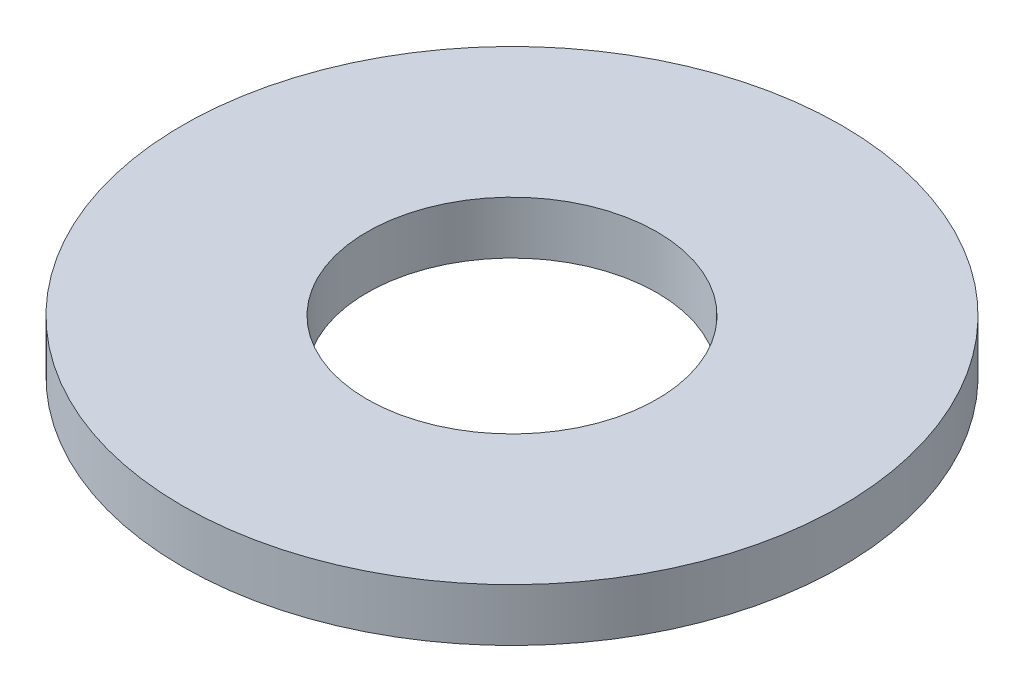
from build123d import *

# Parameters (mm, degrees)
SKETCH1_R           = 2.5
BOSS_EXTRUDE1_DEPTH = 0.4
SKETCH5_R           = 1.1
CUT_EXTRUDE1_DEPTH  = 4.558089375


with BuildPart() as part:
    # Sketch1 → Boss-Extrude1 (new body)
    with BuildSketch(Plane(origin=(0, 0, 0), x_dir=(1, 0, 0), z_dir=(0, 1, 0))):
        Circle(SKETCH1_R)
    extrude(amount=BOSS_EXTRUDE1_DEPTH)

    # Sketch5 → Cut-Extrude1 (cut, through all)
    with BuildSketch(Plane(origin=(0, 0.4, 0), x_dir=(-1, 0, 0), z_dir=(0, 1, 0))):
        Circle(SKETCH5_R)
    extrude(amount=-CUT_EXTRUDE1_DEPTH, mode=Mode.SUBTRACT)


solid = part.part
